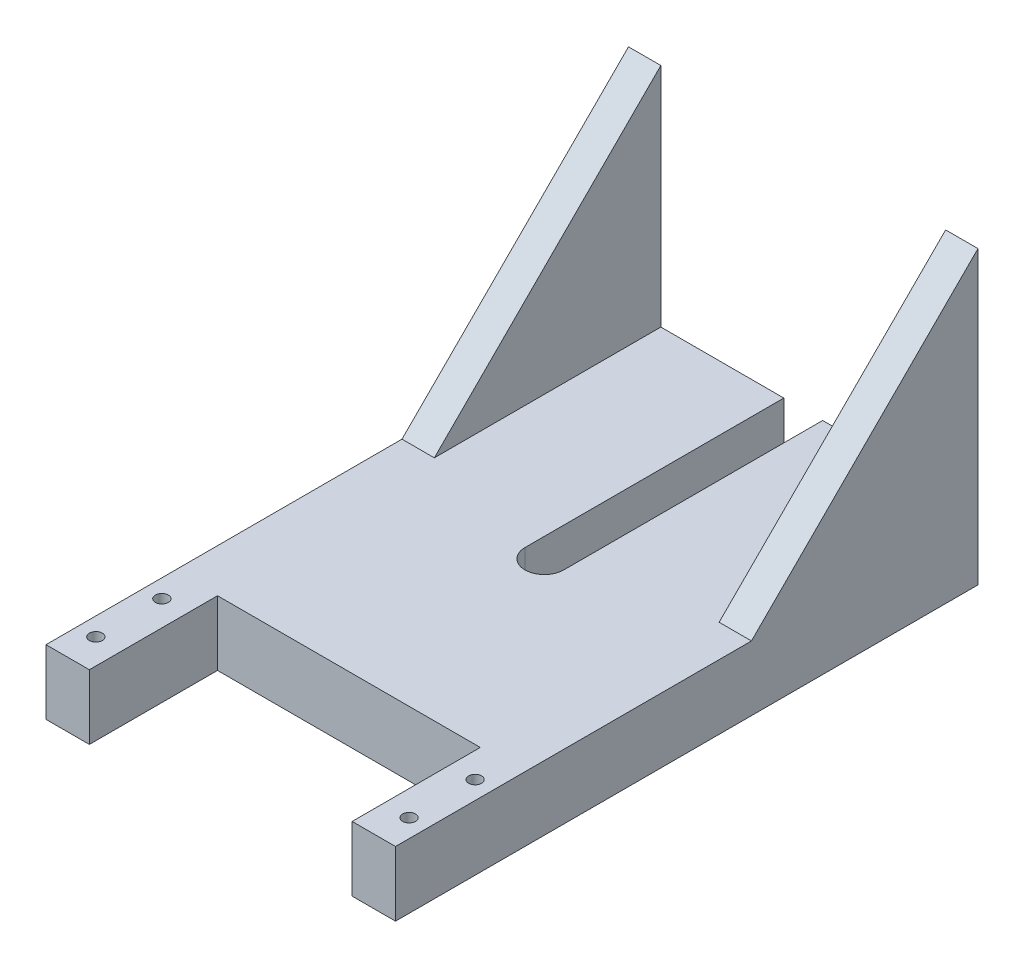
from build123d import *

# Parameters (mm, degrees)
SKETCH1_W           = 54
SKETCH1_H           = 10
BOSS_EXTRUDE1_DEPTH = 90
SKETCH2_W           = 40.6
SKETCH2_H           = 19.8
CUT_EXTRUDE1_DEPTH  = 99.192875432
CUT_EXTRUDE2_DEPTH  = 99.192875432
BOSS_EXTRUDE4_DEPTH = 5
BOSS_EXTRUDE5_DEPTH = 5
SKETCH9_R           = 1
CUT_EXTRUDE3_DEPTH  = 108.549248187


with BuildPart() as part:
    # Sketch1 → Boss-Extrude1 (new body)
    with BuildSketch(Plane.XY):
        with Locations((10.971578656, 527.175634265)):
            Rectangle(SKETCH1_W, SKETCH1_H)
    extrude(amount=BOSS_EXTRUDE1_DEPTH)

    # Sketch2 → Cut-Extrude1 (cut, through all)
    with BuildSketch(Plane.XZ.offset(-522.175634265)):
        with Locations((10.971578656, 80.1)):
            Rectangle(SKETCH2_W, SKETCH2_H)
    extrude(amount=-CUT_EXTRUDE1_DEPTH, mode=Mode.SUBTRACT)

    # Sketch4 → Cut-Extrude2 (cut, through all)
    with BuildSketch(Plane(origin=(0, 532.175634265, 0), x_dir=(1, 0, 0), z_dir=(0, 1, 0))):
        with BuildLine():
            Line((7.971578656, -40), (7.971578656, 0))
            ThreePointArc((7.971578656, 0), (10.971578656, 3), (13.971578656, 0))
            Line((13.971578656, 0), (13.971578656, -40))
            ThreePointArc((13.971578656, -40), (10.971578656, -43), (7.971578656, -40))
        make_face()
    extrude(amount=-CUT_EXTRUDE2_DEPTH, mode=Mode.SUBTRACT)

    # Sketch7 → Boss-Extrude4 (add)
    with BuildSketch(Plane.ZY.offset(16.028421344)):
        Polygon((35, 532.175634265), (0, 567.175634265), (0, 532.175634265), align=None)
    extrude(amount=-BOSS_EXTRUDE4_DEPTH)

    # Sketch8 → Boss-Extrude5 (add)
    with BuildSketch(Plane(origin=(37.971578656, 0, 0), x_dir=(0, 0, -1), z_dir=(1, 0, 0))):
        Polygon((-35, 532.175634265), (0, 567.175634265), (0, 532.175634265), align=None)
    extrude(amount=-BOSS_EXTRUDE5_DEPTH)

    # Sketch9 → Cut-Extrude3 (cut, through all)
    with BuildSketch(Plane.XZ.offset(-522.175634265)):
        with Locations((-13.228421344, 85.1)):
            Circle(SKETCH9_R)
        with Locations((-13.228421344, 74.9)):
            Circle(SKETCH9_R)
        with Locations((35.171578656, 74.9)):
            Circle(SKETCH9_R)
        with Locations((35.171578656, 85.1)):
            Circle(SKETCH9_R)
    extrude(amount=-CUT_EXTRUDE3_DEPTH, mode=Mode.SUBTRACT)


solid = part.part
